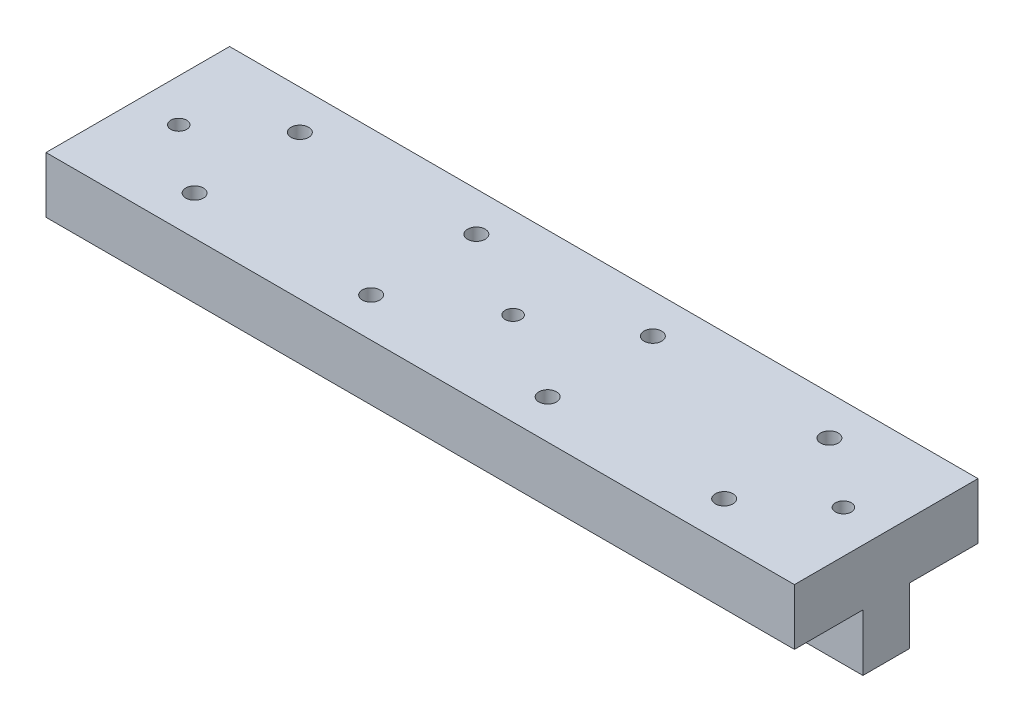
from build123d import *

# Parameters (mm, degrees)
SKETCH4_W                       = 106
SKETCH4_H                       = 16
BOSS_EXTRUDE2_DEPTH             = 13
CUT_EXTRUDE3_START              = -9.7
SKETCH25_W                      = 106
SKETCH25_H                      = 8.1
CUT_EXTRUDE3_DEPTH              = 107.216438698
M3X0_5_TAPPED_HOLE1_D           = 2.5
MIRROR1_START                   = -24.601316976
MIRROR1_OUTLINE_W               = 106
MIRROR1_OUTLINE_H               = 13
MIRROR1_OUTLINE_R               = 1.25
MIRROR1_DEPTH                   = 7.951316976
MIRROR1_START_2                 = -32.65
MIRROR1_2_OUTLINE_W             = 106
MIRROR1_2_OUTLINE_H             = 3.3
MIRROR1_2_DEPTH                 = 8.048683024
F_4_40_TAPPED_HOLE1_D           = 2.2606
F_4_40_TAPPED_HOLE1_ON_FACE_2_D = 2.2606


# Read off the part's stored shape, not the designer's step: Mirror1
with BuildPart() as part:
    # Sketch4 → Boss-Extrude2 (new body)
    with BuildSketch(Plane.XY):
        with Locations((-36.891047602, -24.65)):
            Rectangle(SKETCH4_W, SKETCH4_H)
    extrude(amount=-BOSS_EXTRUDE2_DEPTH)

    # Sketch25 → Cut-Extrude3 (cut)
    with BuildSketch(Plane.XY.offset(CUT_EXTRUDE3_START)):
        with Locations((-36.891047602, -28.651316976)):
            Rectangle(SKETCH25_W, SKETCH25_H)
    extrude(amount=CUT_EXTRUDE3_DEPTH, mode=Mode.SUBTRACT)

    # M3x0.5 Tapped Hole1 (through all)
    with Locations(Plane(origin=(-74.391047602, -16.65, -5.55), x_dir=(0, 0, 1), z_dir=(0, 1, 0))):
        with Locations((0, 0), (0, 25), (0, 75), (0, 50)):
            Hole(M3X0_5_TAPPED_HOLE1_D / 2)

    # Mirror1 outline → Mirror1 (add)
    with BuildSketch(Plane(origin=(0, 0, 0), x_dir=(1, 0, 0), z_dir=(0, 1, 0)).offset(MIRROR1_START)):
        with Locations((-36.891047602, 19.5)):
            Rectangle(MIRROR1_OUTLINE_W, MIRROR1_OUTLINE_H)
        with Locations((-74.391047602, 20.45)):
            Circle(MIRROR1_OUTLINE_R, mode=Mode.SUBTRACT)
        with Locations((-49.391047602, 20.45)):
            Circle(MIRROR1_OUTLINE_R, mode=Mode.SUBTRACT)
        with Locations((-24.391047602, 20.45)):
            Circle(MIRROR1_OUTLINE_R, mode=Mode.SUBTRACT)
        with Locations((0.608952398, 20.45)):
            Circle(MIRROR1_OUTLINE_R, mode=Mode.SUBTRACT)
    extrude(amount=MIRROR1_DEPTH)

    # Mirror1 2 outline → Mirror1 2 (add)
    with BuildSketch(Plane(origin=(0, 0, 0), x_dir=(1, 0, 0), z_dir=(0, 1, 0)).offset(MIRROR1_START_2)):
        with Locations((-36.891047602, 14.65)):
            Rectangle(MIRROR1_2_OUTLINE_W, MIRROR1_2_OUTLINE_H)
    extrude(amount=MIRROR1_2_DEPTH)

    # #4-40 Tapped Hole1 (through all)
    with Locations(Plane(origin=(-83.891047602, -32.65, -12.801414568), x_dir=(0, 0, -1), z_dir=(0, -1, 0))):
        with Locations((0, 0), (0.13677014, 94), (0.355392609, 47)):
            Hole(F_4_40_TAPPED_HOLE1_D / 2)

    # #4-40 Tapped Hole1 on face 2 (through all)
    with Locations(Plane(origin=(-13.707536503, 0, 46.33240541), x_dir=(0, 0, -1), z_dir=(0, -1, 0))):
        with Locations((0, 0)):
            Hole(F_4_40_TAPPED_HOLE1_ON_FACE_2_D / 2)


solid = part.part
